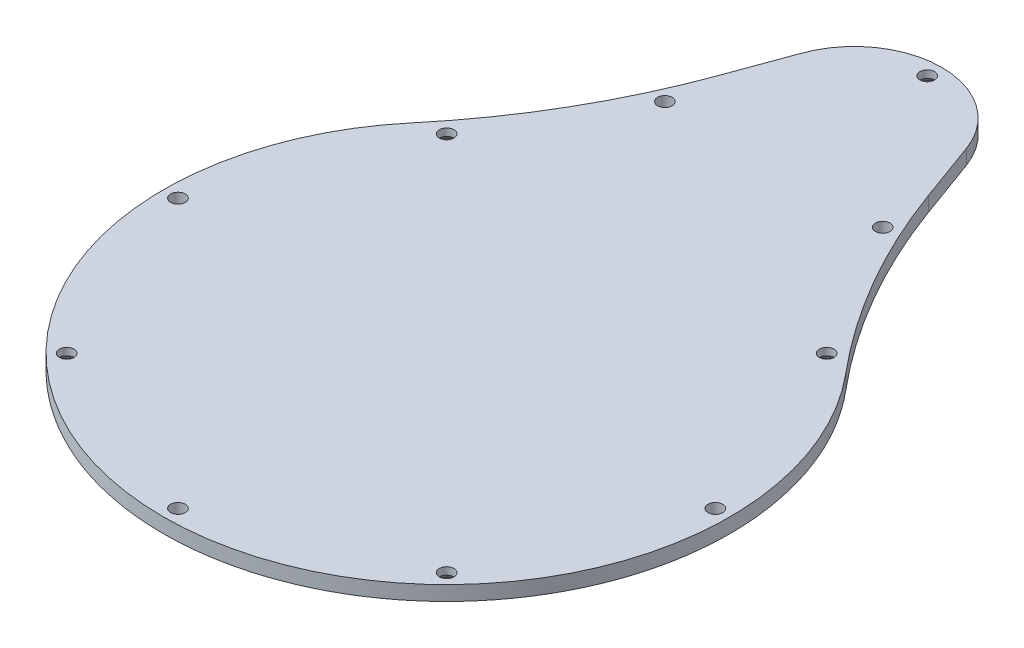
from build123d import *

# Parameters (mm, degrees)
SKETCH1_R           = 3.175
BOSS_EXTRUDE1_DEPTH = 6.35
CHAMFER1_SIZE       = 3.175


with BuildPart() as part:
    # Sketch1 → Boss-Extrude1 (new body)
    with BuildSketch(Plane.XZ.offset(109.25)):
        with BuildLine():
            ThreePointArc((-94.300070948, -79.127154752), (-66.095055559, -119.40809126), (-45.31324895, -163.974819355))
            Line((-45.31324895, -163.974819355), (-35.802288852, -190.105967461))
            ThreePointArc((-35.802288852, -190.105967461), (0, -215.175), (35.802288852, -190.105967461))
            Line((35.802288852, -190.105967461), (45.31324895, -163.974819355))
            ThreePointArc((45.31324895, -163.974819355), (66.095055559, -119.40809126), (94.300070948, -79.127154752))
            ThreePointArc((94.300070948, -79.127154752), (0, 123.1), (-94.300070948, -79.127154752))
        make_face()
        with Locations(Location((-47.329330924, -142.15, 0), (0, 0, 270))):
            Circle(SKETCH1_R, mode=Mode.SUBTRACT)
        with Locations(Location((-82.554716704, -82.554716704, 0), (0, 0, 270))):
            Circle(SKETCH1_R, mode=Mode.SUBTRACT)
        with Locations(Location((0, -208.825, 0), (0, 0, 270))):
            Circle(SKETCH1_R, mode=Mode.SUBTRACT)
        with Locations(Location((47.329330924, -142.15, 0), (0, 0, 270))):
            Circle(SKETCH1_R, mode=Mode.SUBTRACT)
        with Locations(Location((82.554716704, -82.554716704, 0), (0, 0, 270))):
            Circle(SKETCH1_R, mode=Mode.SUBTRACT)
        with Locations(Location((-116.75, 0, 0), (0, 0, 270))):
            Circle(SKETCH1_R, mode=Mode.SUBTRACT)
        with Locations(Location((-82.554716704, 82.554716704, 0), (0, 0, 270))):
            Circle(SKETCH1_R, mode=Mode.SUBTRACT)
        with Locations(Location((116.75, 0, 0), (0, 0, 270))):
            Circle(SKETCH1_R, mode=Mode.SUBTRACT)
        with Locations(Location((0, 116.75, 0), (0, 0, 270))):
            Circle(SKETCH1_R, mode=Mode.SUBTRACT)
        with Locations(Location((82.554716704, 82.554716704, 0), (0, 0, 270))):
            Circle(SKETCH1_R, mode=Mode.SUBTRACT)
    extrude(amount=BOSS_EXTRUDE1_DEPTH)

    # Chamfer1
    chamfer1_edges = [part.edges().sort_by_distance(p)[0] for p in [
        (0, -115.6, -205.65),
        (82.554716704, -115.6, 85.729716704),
        (-82.554716704, -115.6, -79.379716704),
        (-82.554716704, -115.6, 85.729716704),
        (82.554716704, -115.6, -79.379716704),
    ]]
    chamfer(chamfer1_edges, length=CHAMFER1_SIZE - 0.0001)  # a hair under: the kernel refuses the full size


solid = part.part
